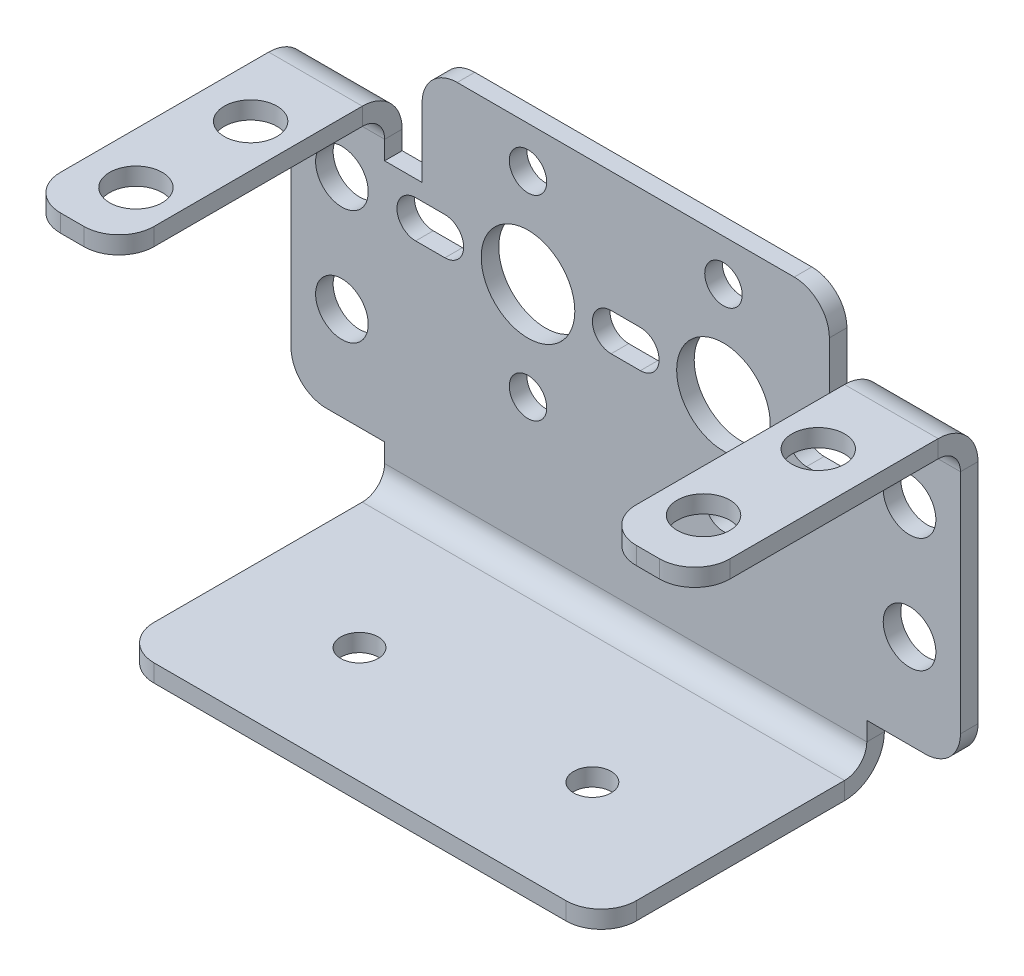
from build123d import *

# Parameters (mm, degrees)
ESQUISSE1_R                           = 2.25
ESQUISSE1_R_2                         = 4
ESQUISSE1_R_3                         = 1.6
T_LE_DE_BASE_PLI_E1_DEPTH             = 1.5
T_LE_PLI_E_SUR_AR_TE1_STRIP_W         = 9.81
T_LE_PLI_E_SUR_AR_TE1_STRIP_H         = 1.5
T_LE_PLI_E_SUR_AR_TE1_STRIP_CUT_DEPTH = 41.2
T_LE_PLI_E_SUR_AR_TE1_DEPTH           = 41.2
CONG_1_R                              = 3
ESQUISSE9_R                           = 1.6
ENL_V_MAT_EXTRU_1_DEPTH               = 10
T_LE_PLI_E_SUR_AR_TE2_STRIP_W         = 9.81
T_LE_PLI_E_SUR_AR_TE2_STRIP_H         = 1.5
T_LE_PLI_E_SUR_AR_TE2_STRIP_CUT_DEPTH = 8
T_LE_PLI_E_SUR_AR_TE2_DEPTH           = 8
T_LE_PLI_E_SUR_AR_TE3_STRIP_W         = 9.81
T_LE_PLI_E_SUR_AR_TE3_STRIP_H         = 1.5
T_LE_PLI_E_SUR_AR_TE3_STRIP_CUT_DEPTH = 8
T_LE_PLI_E_SUR_AR_TE3_DEPTH           = 8
CONG_2_R                              = 3
ESQUISSE16_R                          = 2.25
ENL_V_MAT_EXTRU_2_DEPTH               = 10


# Sheet-metal steps are written as plain solids
with BuildPart() as part:
    # Esquisse1 → Tôle de base pliée1 (new body)
    with BuildSketch(Plane.XY):
        with BuildLine():
            Line((52.684779063, 187.695605254), (52.684779063, 166.115117635))
            ThreePointArc((52.684779063, 166.115117635), (53.563458719, 163.993797291), (55.684779063, 163.115117635))
            Line((55.684779063, 163.115117635), (60.684779063, 163.115117635))
            Line((60.684779063, 163.115117635), (60.684779063, 158.115117635))
            Line((60.684779063, 158.115117635), (101.884779063, 158.115117635))
            Line((101.884779063, 158.115117635), (101.884779063, 163.115117635))
            Line((101.884779063, 163.115117635), (106.884779063, 163.115117635))
            ThreePointArc((106.884779063, 163.115117635), (109.006099406, 163.993797291), (109.884779063, 166.115117635))
            Line((109.884779063, 166.115117635), (109.884779063, 187.695605254))
            Line((109.884779063, 187.695605254), (109.884779063, 188.915117635))
            Line((109.884779063, 188.915117635), (101.884779063, 188.915117635))
            Line((101.884779063, 188.915117635), (101.884779063, 183.915117635))
            Line((101.884779063, 183.915117635), (98.684779063, 183.915117635))
            Line((98.684779063, 183.915117635), (98.684779063, 189.815117635))
            ThreePointArc((98.684779063, 189.815117635), (97.806099406, 191.936437979), (95.684779063, 192.815117635))
            Line((95.684779063, 192.815117635), (66.884779063, 192.815117635))
            ThreePointArc((66.884779063, 192.815117635), (64.763458719, 191.936437979), (63.884779063, 189.815117635))
            Line((63.884779063, 189.815117635), (63.884779063, 183.915117635))
            Line((63.884779063, 183.915117635), (60.684779063, 183.915117635))
            Line((60.684779063, 183.915117635), (60.684779063, 188.915117635))
            Line((60.684779063, 188.915117635), (52.684779063, 188.915117635))
            Line((52.684779063, 188.915117635), (52.684779063, 187.695605254))
        make_face()
        with Locations((57.034779063, 180.915117635)):
            Circle(ESQUISSE1_R, mode=Mode.SUBTRACT)
        with Locations((57.034779063, 171.115117635)):
            Circle(ESQUISSE1_R, mode=Mode.SUBTRACT)
        with Locations((72.934779063, 180.915117635)):
            Circle(ESQUISSE1_R_2, mode=Mode.SUBTRACT)
        with Locations((72.934779063, 189.265117635)):
            Circle(ESQUISSE1_R_3, mode=Mode.SUBTRACT)
        with Locations((72.934779063, 172.565117635)):
            Circle(ESQUISSE1_R_3, mode=Mode.SUBTRACT)
        with Locations(Location((89.634779063, 172.565117635, 0), (0, 0, 180))):
            Circle(ESQUISSE1_R_3, mode=Mode.SUBTRACT)
        with Locations(Location((89.634779063, 189.265117635, 0), (0, 0, 180))):
            Circle(ESQUISSE1_R_3, mode=Mode.SUBTRACT)
        with Locations(Location((89.634779063, 180.915117635, 0), (0, 0, 180))):
            Circle(ESQUISSE1_R_2, mode=Mode.SUBTRACT)
        with Locations(Location((105.534779063, 171.115117635, 0), (0, 0, 180))):
            Circle(ESQUISSE1_R, mode=Mode.SUBTRACT)
        with Locations(Location((105.534779063, 180.915117635, 0), (0, 0, 180))):
            Circle(ESQUISSE1_R, mode=Mode.SUBTRACT)
        with BuildLine():
            Line((63.334779063, 182.515117635), (65.834779063, 182.515117635))
            ThreePointArc((65.834779063, 182.515117635), (67.434779063, 180.915117635), (65.834779063, 179.315117635))
            Line((65.834779063, 179.315117635), (63.334779063, 179.315117635))
            ThreePointArc((63.334779063, 179.315117635), (61.734779063, 180.915117635), (63.334779063, 182.515117635))
        make_face(mode=Mode.SUBTRACT)
        with BuildLine():
            Line((82.534779063, 182.515117635), (80.034779063, 182.515117635))
            ThreePointArc((80.034779063, 182.515117635), (78.434779063, 180.915117635), (80.034779063, 179.315117635))
            Line((80.034779063, 179.315117635), (82.534779063, 179.315117635))
            ThreePointArc((82.534779063, 179.315117635), (84.134779063, 180.915117635), (82.534779063, 182.515117635))
        make_face(mode=Mode.SUBTRACT)
        with BuildLine():
            Line((99.234779063, 182.515117635), (96.734779063, 182.515117635))
            ThreePointArc((96.734779063, 182.515117635), (95.134779063, 180.915117635), (96.734779063, 179.315117635))
            Line((96.734779063, 179.315117635), (99.234779063, 179.315117635))
            ThreePointArc((99.234779063, 179.315117635), (100.834779063, 180.915117635), (99.234779063, 182.515117635))
        make_face(mode=Mode.SUBTRACT)
    extrude(amount=-T_LE_DE_BASE_PLI_E1_DEPTH)

    # Tôle pliée sur arête1 strip (across the edge) → Tôle pliée sur arête1 strip cut (cut)
    with BuildSketch(Plane(origin=(60.684779063, 158.115117635, 0), x_dir=(0, 1, 0), z_dir=(1, 0, 0))):
        with Locations((-1.5, -0.75)):
            Rectangle(T_LE_PLI_E_SUR_AR_TE1_STRIP_W, T_LE_PLI_E_SUR_AR_TE1_STRIP_H)
    extrude(amount=T_LE_PLI_E_SUR_AR_TE1_STRIP_CUT_DEPTH, mode=Mode.SUBTRACT)

    # Tôle pliée sur arête1 section (across the edge) → Tôle pliée sur arête1 (add)
    with BuildSketch(Plane(origin=(60.684779063, 158.115117635, 0), x_dir=(0, 1, 0), z_dir=(1, 0, 0))):
        with BuildLine():
            Line((0, 1.905), (0, 22.7))
            Line((0, 22.7), (1.5, 22.7))
            Line((1.5, 22.7), (1.5, 1.905))
            ThreePointArc((1.5, 1.905), (2.057961582, 0.557961582), (3.405, 0))
            Line((3.405, 0), (3.405, -1.5))
            ThreePointArc((3.405, -1.5), (0.99730141, -0.50269859), (0, 1.905))
        make_face()
    extrude(amount=T_LE_PLI_E_SUR_AR_TE1_DEPTH)

    # Congé1
    cong_1_edges = [part.edges().sort_by_distance(p)[0] for p in [
        (60.684779063, 158.865117635, 22.7),
        (101.884779063, 158.865117635, 22.7),
    ]]
    fillet(cong_1_edges, radius=CONG_1_R)

    # Esquisse9 → Enlèv. mat.-Extru.1 (cut)
    with BuildSketch(Plane(origin=(0, 159.615117635, 0), x_dir=(1, 0, 0), z_dir=(0, 1, 0))):
        with Locations(Location((71.334779063, -12.8, 0), (0, 0, 270))):
            Circle(ESQUISSE9_R)
        with Locations(Location((91.234779063, -12.8, 0), (0, 0, 270))):
            Circle(ESQUISSE9_R)
    extrude(amount=-ENL_V_MAT_EXTRU_1_DEPTH, mode=Mode.SUBTRACT)

    # Tôle pliée sur arête2 strip (across the edge) → Tôle pliée sur arête2 strip cut (cut)
    with BuildSketch(Plane(origin=(60.684779063, 188.915117635, 0), x_dir=(0, -1, 0), z_dir=(-1, 0, 0))):
        with Locations((-1.5, -0.75)):
            Rectangle(T_LE_PLI_E_SUR_AR_TE2_STRIP_W, T_LE_PLI_E_SUR_AR_TE2_STRIP_H)
    extrude(amount=T_LE_PLI_E_SUR_AR_TE2_STRIP_CUT_DEPTH, mode=Mode.SUBTRACT)

    # Tôle pliée sur arête2 section (across the edge) → Tôle pliée sur arête2 (add)
    with BuildSketch(Plane(origin=(60.684779063, 188.915117635, 0), x_dir=(0, -1, 0), z_dir=(-1, 0, 0))):
        with BuildLine():
            Line((0, 1.905), (0, 22.7))
            Line((0, 22.7), (1.5, 22.7))
            Line((1.5, 22.7), (1.5, 1.905))
            ThreePointArc((1.5, 1.905), (2.057961582, 0.557961582), (3.405, 0))
            Line((3.405, 0), (3.405, -1.5))
            ThreePointArc((3.405, -1.5), (0.99730141, -0.50269859), (0, 1.905))
        make_face()
    extrude(amount=T_LE_PLI_E_SUR_AR_TE2_DEPTH)

    # Tôle pliée sur arête3 strip (across the edge) → Tôle pliée sur arête3 strip cut (cut)
    with BuildSketch(Plane(origin=(109.884779063, 188.915117635, 0), x_dir=(0, -1, 0), z_dir=(-1, 0, 0))):
        with Locations((-1.5, -0.75)):
            Rectangle(T_LE_PLI_E_SUR_AR_TE3_STRIP_W, T_LE_PLI_E_SUR_AR_TE3_STRIP_H)
    extrude(amount=T_LE_PLI_E_SUR_AR_TE3_STRIP_CUT_DEPTH, mode=Mode.SUBTRACT)

    # Tôle pliée sur arête3 section (across the edge) → Tôle pliée sur arête3 (add)
    with BuildSketch(Plane(origin=(109.884779063, 188.915117635, 0), x_dir=(0, -1, 0), z_dir=(-1, 0, 0))):
        with BuildLine():
            Line((0, 1.905), (0, 22.7))
            Line((0, 22.7), (1.5, 22.7))
            Line((1.5, 22.7), (1.5, 1.905))
            ThreePointArc((1.5, 1.905), (2.057961582, 0.557961582), (3.405, 0))
            Line((3.405, 0), (3.405, -1.5))
            ThreePointArc((3.405, -1.5), (0.99730141, -0.50269859), (0, 1.905))
        make_face()
    extrude(amount=T_LE_PLI_E_SUR_AR_TE3_DEPTH)

    # Congé2
    cong_2_edges = [part.edges().sort_by_distance(p)[0] for p in [
        (60.684779063, 188.165117635, 22.7),
        (52.684779063, 188.165117635, 22.7),
        (109.884779063, 188.165117635, 22.7),
        (101.884779063, 188.165117635, 22.7),
    ]]
    fillet(cong_2_edges, radius=CONG_2_R)

    # Esquisse16 → Enlèv. mat.-Extru.2 (cut)
    with BuildSketch(Plane(origin=(0, 188.915117635, 0), x_dir=(1, 0, 0), z_dir=(0, 1, 0))):
        with Locations(Location((57.034779063, -7.8, 0), (0, 0, 270))):
            Circle(ESQUISSE16_R)
        with Locations(Location((57.034779063, -17.6, 0), (0, 0, 270))):
            Circle(ESQUISSE16_R)
        with Locations(Location((105.534779063, -7.8, 0), (0, 0, 270))):
            Circle(ESQUISSE16_R)
        with Locations(Location((105.534779063, -17.6, 0), (0, 0, 270))):
            Circle(ESQUISSE16_R)
    extrude(amount=-ENL_V_MAT_EXTRU_2_DEPTH, mode=Mode.SUBTRACT)


solid = part.part
